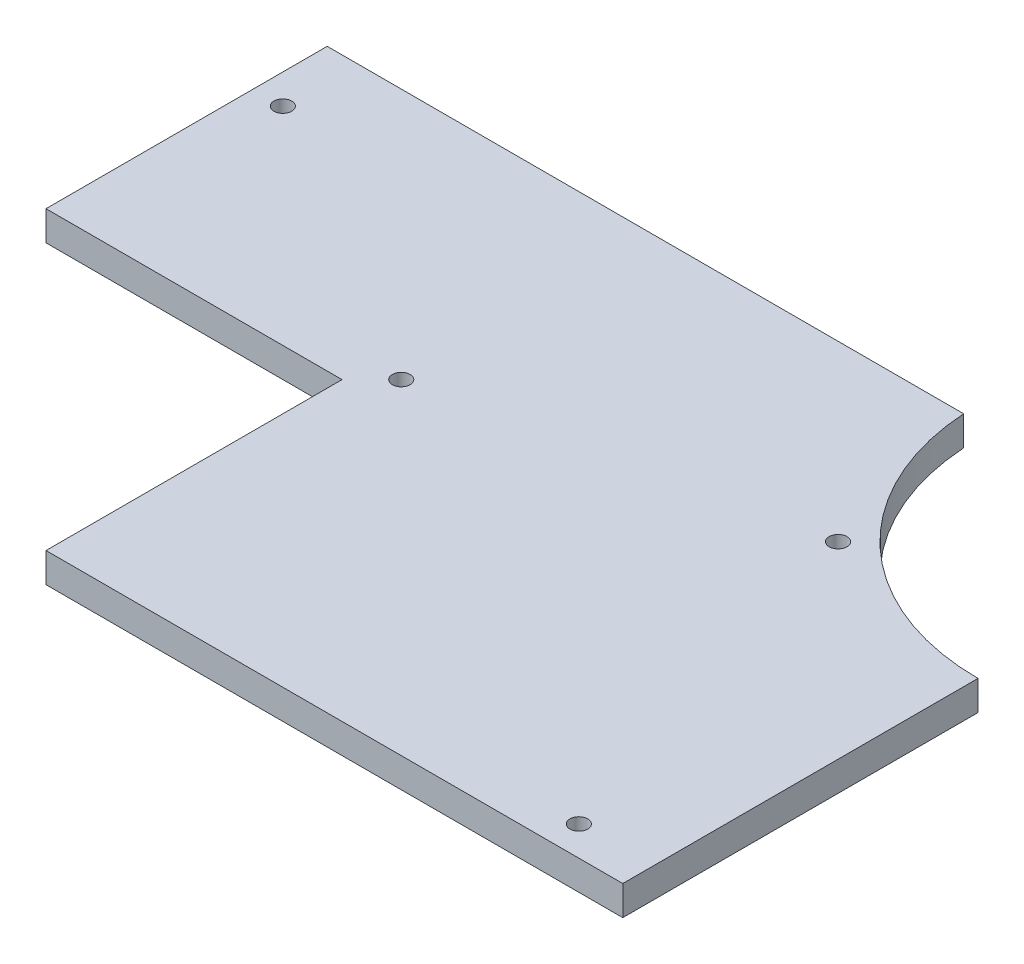
from build123d import *

# Parameters (mm, degrees)
ESQUISSE1_R        = 1.5
BOSS_EXTRU_1_DEPTH = 5


with BuildPart() as part:
    # Esquisse1 → Boss.-Extru.1 (new body)
    with BuildSketch(Plane(origin=(0, 0, 0), x_dir=(1, 0, 0), z_dir=(0, 1, 0))):
        with BuildLine():
            Line((-97.415, -97.415), (0, -97.415))
            Line((0, -97.415), (0, -37.415))
            ThreePointArc((0, -37.415), (-27.386127875, -26.569759474), (-39.921798557, 0.085))
            Line((-39.921798557, 0.085), (-147.415, 0.085))
            Line((-147.415, 0.085), (-147.415, -47.415))
            Line((-147.415, -47.415), (-97.415, -47.415))
            Line((-97.415, -47.415), (-97.415, -97.415))
        make_face()
        with Locations((-12.415, -92.415)):
            Circle(ESQUISSE1_R, mode=Mode.SUBTRACT)
        with Locations((-92.415, -42.415)):
            Circle(ESQUISSE1_R, mode=Mode.SUBTRACT)
        with Locations((-142.415, -12.415)):
            Circle(ESQUISSE1_R, mode=Mode.SUBTRACT)
        with Locations((-31.819805153, -29.234805153)):
            Circle(ESQUISSE1_R, mode=Mode.SUBTRACT)
    extrude(amount=BOSS_EXTRU_1_DEPTH)


solid = part.part
